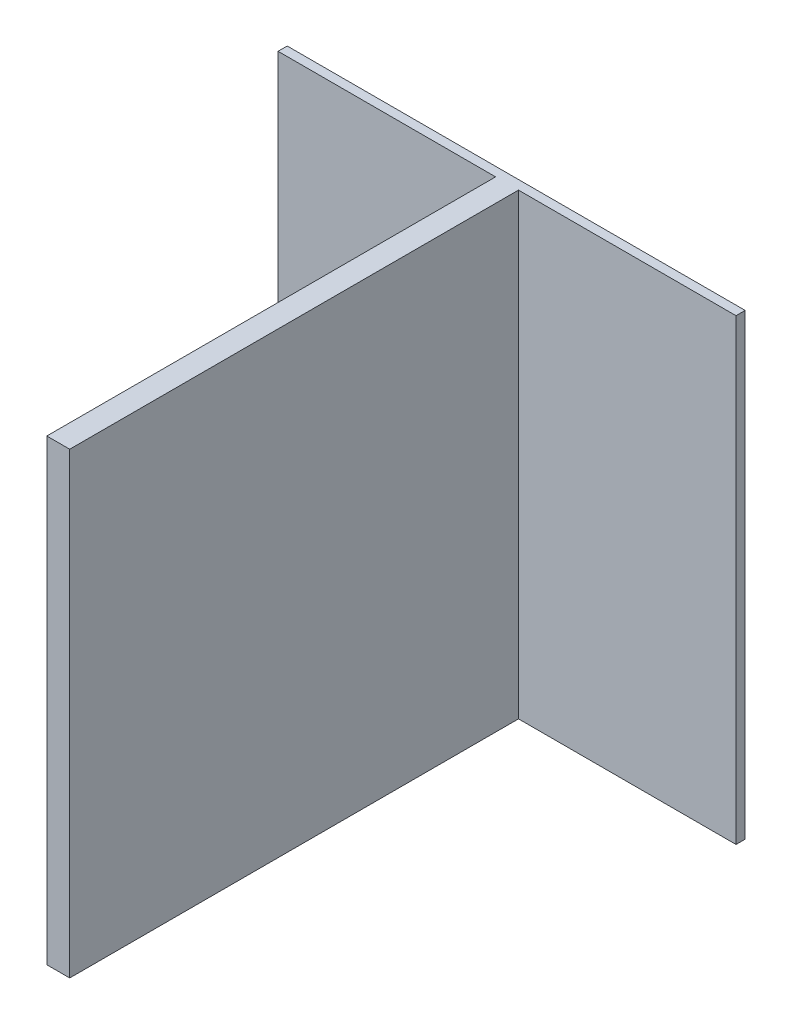
from build123d import *

# Parameters (mm, degrees)
SZKIC1_W                    = 200
SZKIC1_H                    = 200
DODANIE_WYCI_GNI_CIE1_DEPTH = 4
SZKIC2_W                    = 10
SZKIC2_H                    = 200
DODANIE_WYCI_GNI_CIE2_DEPTH = 196


with BuildPart() as part:
    # Szkic1 → Dodanie-wyciągnięcie1 (new body)
    with BuildSketch(Plane.XY):
        Rectangle(SZKIC1_W, SZKIC1_H)
    extrude(amount=DODANIE_WYCI_GNI_CIE1_DEPTH)

    # Szkic2 → Dodanie-wyciągnięcie2 (add)
    with BuildSketch(Plane.XY.offset(4)):
        Rectangle(SZKIC2_W, SZKIC2_H)
    extrude(amount=DODANIE_WYCI_GNI_CIE2_DEPTH)


solid = part.part
